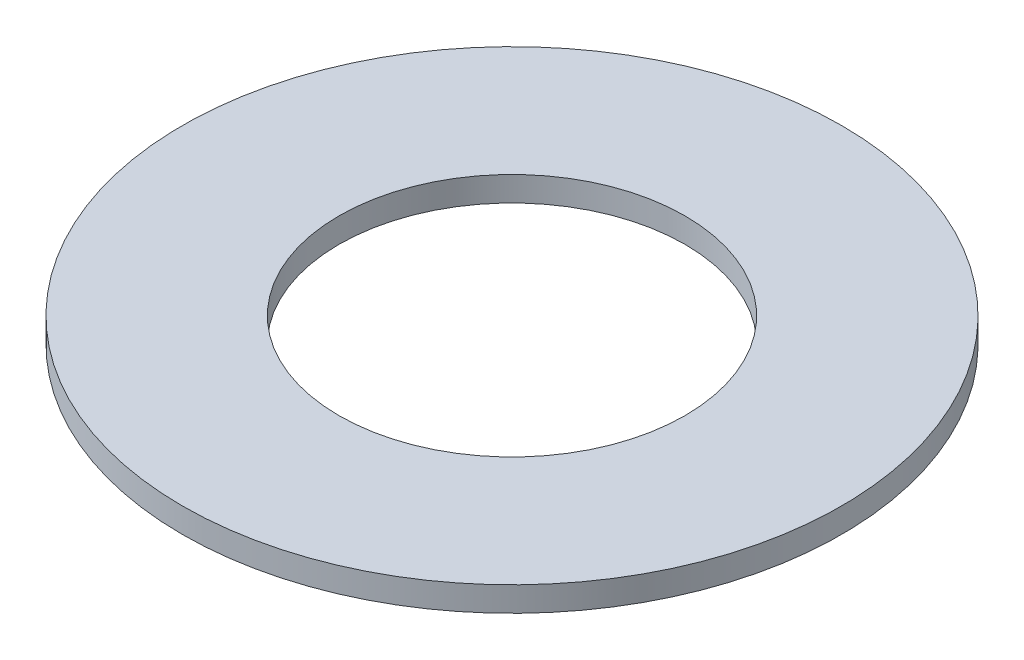
from build123d import *

# Parameters (mm, degrees)
SKETCH1_R           = 10.16
SKETCH1_R_2         = 5.334
BOSS_EXTRUDE1_DEPTH = 0.762


with BuildPart() as part:
    # Sketch1 → Boss-Extrude1 (new body)
    with BuildSketch(Plane(origin=(0, 0, 0), x_dir=(1, 0, 0), z_dir=(0, 1, 0))):
        Circle(SKETCH1_R)
        Circle(SKETCH1_R_2, mode=Mode.SUBTRACT)
    extrude(amount=BOSS_EXTRUDE1_DEPTH)


solid = part.part
